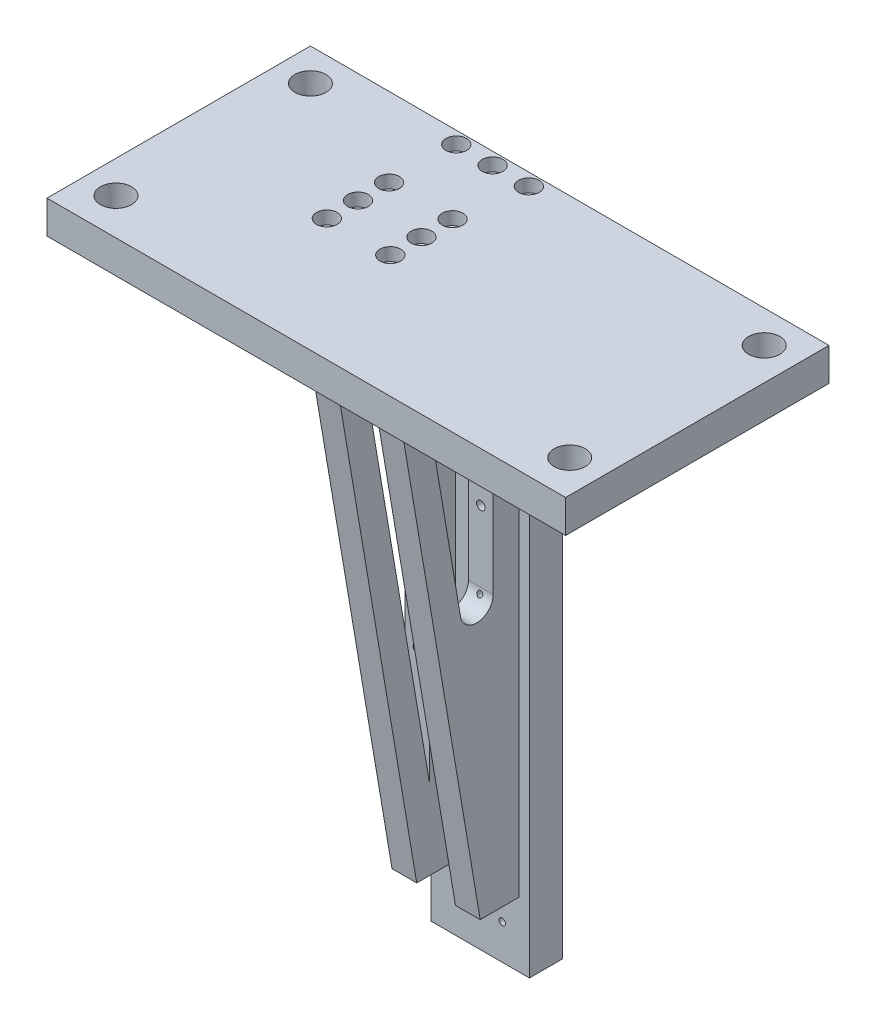
from build123d import *

# Parameters (mm, degrees)
BOSS_EXTRUDE5_DEPTH             = 125
BOSS_EXTRUDE5_DEPTH_BACK        = 75
SKETCH1_W                       = 101.6
SKETCH1_H                       = 9.525
SKETCH1_W_2                     = 87.07
SKETCH1_H_2                     = 3.175
SKETCH1_5_W                     = 9.525
SKETCH1_5_H                     = 250
BOSS_EXTRUDE6_DEPTH             = 19
BOSS_EXTRUDE7_DEPTH             = 3.175
SKETCH6_W                       = 20
SKETCH6_H                       = 5.005
SKETCH6_W_2                     = 5
SKETCH6_H_2                     = 5
BOSS_EXTRUDE8_DEPTH             = 3.175
BOSS_EXTRUDE9_START             = 5.475
BOSS_EXTRUDE9_DEPTH             = 9.525
BOSS_EXTRUDE10_START            = -9.475
BOSS_EXTRUDE10_DEPTH            = 9.525
FILLET1_R                       = 6.35
CBORE_FOR_M4_SHCS1_AT_2_COUNT   = 2
CBORE_FOR_M4_SHCS1_AT_2_PITCH   = 30
CBORE_FOR_M4_SHCS1_AT_3_COUNT   = 2
CBORE_FOR_M4_SHCS1_AT_3_PITCH   = 30
CBORE_FOR_M4_SHCS1_AT_4_COUNT   = 2
CBORE_FOR_M4_SHCS1_AT_4_PITCH   = 60
CBORE_FOR_M4_SHCS1_AT_5_COUNT   = 2
CBORE_FOR_M4_SHCS1_AT_5_PITCH   = 90
CBORE_FOR_M4_SHCS1_AT_6_COUNT   = 2
CBORE_FOR_M4_SHCS1_AT_6_PITCH   = 120
CBORE_FOR_M4_SHCS1_AT_7_COUNT   = 2
CBORE_FOR_M4_SHCS1_AT_7_PITCH   = 150
CBORE_FOR_M4_SHCS1_AT_8_COUNT   = 2
CBORE_FOR_M4_SHCS1_AT_8_PITCH   = 151.983636043
CBORE_FOR_M4_SHCS1_AT_9_COUNT   = 2
CBORE_FOR_M4_SHCS1_AT_9_PITCH   = 122.470509205
CBORE_FOR_M4_SHCS1_AT_10_COUNT  = 2
CBORE_FOR_M4_SHCS1_AT_10_PITCH  = 93.268567186
CBORE_FOR_M4_SHCS1_AT_11_COUNT  = 2
CBORE_FOR_M4_SHCS1_AT_11_PITCH  = 64.799889082
CBORE_FOR_M4_SHCS1_AT_12_COUNT  = 2
CBORE_FOR_M4_SHCS1_AT_12_PITCH  = 38.717252291
CBORE_FOR_M4_SHCS1_AT_13_COUNT  = 2
CBORE_FOR_M4_SHCS1_AT_13_PITCH  = 24.475
CBORE_FOR_M4_SHCS1_AT_14_COUNT  = 2
CBORE_FOR_M4_SHCS1_AT_14_PITCH  = 38.717252291
CBORE_FOR_M4_SHCS2_AT_2_COUNT   = 2
CBORE_FOR_M4_SHCS2_AT_2_PITCH   = 12
CBORE_FOR_M4_SHCS2_AT_3_COUNT   = 2
CBORE_FOR_M4_SHCS2_AT_3_PITCH   = 24
CBORE_FOR_M4_SHCS2_AT_4_COUNT   = 2
CBORE_FOR_M4_SHCS2_AT_4_PITCH   = 34.278646779
CBORE_FOR_M4_SHCS2_AT_5_COUNT   = 2
CBORE_FOR_M4_SHCS2_AT_5_PITCH   = 27.258496382
CBORE_FOR_M4_SHCS2_AT_6_COUNT   = 2
CBORE_FOR_M4_SHCS2_AT_6_PITCH   = 24.475
CBORE_FOR_M4_SHCS2_AT_7_COUNT   = 2
CBORE_FOR_M4_SHCS2_AT_7_PITCH   = 38.156523852
CBORE_FOR_M4_SHCS2_AT_8_COUNT   = 2
CBORE_FOR_M4_SHCS2_AT_8_PITCH   = 29.347407253
CBORE_FOR_M4_SHCS2_AT_9_COUNT   = 2
CBORE_FOR_M4_SHCS2_AT_9_PITCH   = 25.663598978
M4X0_7_TAPPED_HOLE1_AT_2_COUNT  = 2
M4X0_7_TAPPED_HOLE1_AT_2_PITCH  = 12
M4X0_7_TAPPED_HOLE1_AT_3_COUNT  = 2
M4X0_7_TAPPED_HOLE1_AT_3_PITCH  = 24
M4X0_7_TAPPED_HOLE1_AT_4_COUNT  = 2
M4X0_7_TAPPED_HOLE1_AT_4_PITCH  = 34.278646779
M4X0_7_TAPPED_HOLE1_AT_5_COUNT  = 2
M4X0_7_TAPPED_HOLE1_AT_5_PITCH  = 27.258496382
M4X0_7_TAPPED_HOLE1_AT_6_COUNT  = 2
M4X0_7_TAPPED_HOLE1_AT_6_PITCH  = 24.475
M4X0_7_TAPPED_HOLE2_AT_2_COUNT  = 2
M4X0_7_TAPPED_HOLE2_AT_2_PITCH  = 24.475
M4X0_7_TAPPED_HOLE2_AT_3_COUNT  = 2
M4X0_7_TAPPED_HOLE2_AT_3_PITCH  = 38.717252291
M4X0_7_TAPPED_HOLE2_AT_4_COUNT  = 2
M4X0_7_TAPPED_HOLE2_AT_4_PITCH  = 30
M4X0_7_TAPPED_HOLE2_AT_5_COUNT  = 2
M4X0_7_TAPPED_HOLE2_AT_5_PITCH  = 60
M4X0_7_TAPPED_HOLE2_AT_6_COUNT  = 2
M4X0_7_TAPPED_HOLE2_AT_6_PITCH  = 64.799889082
M4X0_7_TAPPED_HOLE2_AT_7_COUNT  = 2
M4X0_7_TAPPED_HOLE2_AT_7_PITCH  = 90
M4X0_7_TAPPED_HOLE2_AT_8_COUNT  = 2
M4X0_7_TAPPED_HOLE2_AT_8_PITCH  = 93.268567186
M4X0_7_TAPPED_HOLE2_AT_9_COUNT  = 2
M4X0_7_TAPPED_HOLE2_AT_9_PITCH  = 120
M4X0_7_TAPPED_HOLE2_AT_10_COUNT = 2
M4X0_7_TAPPED_HOLE2_AT_10_PITCH = 122.470509205
M4X0_7_TAPPED_HOLE2_AT_11_COUNT = 2
M4X0_7_TAPPED_HOLE2_AT_11_PITCH = 150
M4X0_7_TAPPED_HOLE2_AT_12_COUNT = 2
M4X0_7_TAPPED_HOLE2_AT_12_PITCH = 151.983636043
M4X0_7_TAPPED_HOLE2_AT_13_COUNT = 2
M4X0_7_TAPPED_HOLE2_AT_13_PITCH = 180
M4X0_7_TAPPED_HOLE2_AT_14_COUNT = 2
M4X0_7_TAPPED_HOLE2_AT_14_PITCH = 181.656339347
FILLET2_R                       = 6.35
SKETCH23_W                      = 80
SKETCH23_H                      = 14.53
SKETCH23_W_2                    = 35
BOSS_EXTRUDE11_DEPTH            = 3.175
SKETCH22_W                      = 6
SKETCH22_H                      = 259.525
M10_CLEARANCE_HOLE1_AT_2_COUNT  = 2
M10_CLEARANCE_HOLE1_AT_2_PITCH  = 75
M10_CLEARANCE_HOLE1_AT_3_COUNT  = 2
M10_CLEARANCE_HOLE1_AT_3_PITCH  = 190.394327647
M10_CLEARANCE_HOLE1_AT_4_COUNT  = 2
M10_CLEARANCE_HOLE1_AT_4_PITCH  = 175
FILLET3_R                       = 6.35
M4X0_7_TAPPED_HOLE3_AT_2_COUNT  = 2
M4X0_7_TAPPED_HOLE3_AT_2_PITCH  = 14
M4X0_7_TAPPED_HOLE3_AT_3_COUNT  = 2
M4X0_7_TAPPED_HOLE3_AT_3_PITCH  = 28
SKETCH28_W                      = 1.25
SKETCH28_H                      = 101.6
M3X0_5_TAPPED_HOLE1_AT_2_COUNT  = 2
M3X0_5_TAPPED_HOLE1_AT_2_PITCH  = 17
M3X0_5_TAPPED_HOLE1_AT_3_COUNT  = 2
M3X0_5_TAPPED_HOLE1_AT_3_PITCH  = 225
M3X0_5_TAPPED_HOLE1_AT_4_COUNT  = 2
M3X0_5_TAPPED_HOLE1_AT_4_PITCH  = 225.641308275


with BuildPart() as part:
    # Sketch1 → Boss-Extrude5 (new, two sides: drawn at the far end of the back side and taken through both)
    with BuildSketch(Plane(origin=(0, 0, 0), x_dir=(0, 0, -1), z_dir=(1, 0, 0)).offset(-BOSS_EXTRUDE5_DEPTH_BACK)):
        with Locations((-41.275, 4.7625)):
            Rectangle(SKETCH1_W, SKETCH1_H)
        with Locations((-48.54, -1.5875)):
            Rectangle(SKETCH1_W_2, SKETCH1_H_2)
    extrude(amount=BOSS_EXTRUDE5_DEPTH + BOSS_EXTRUDE5_DEPTH_BACK)

    # Sketch6 → Boss-Extrude8 (add)
    with BuildSketch(Plane.XZ):
        with Locations((0, 2.5025)):
            Rectangle(SKETCH6_W, SKETCH6_H)
        with Locations((21.5, -5.025)):
            Rectangle(SKETCH6_W_2, SKETCH6_H_2)
    extrude(amount=BOSS_EXTRUDE8_DEPTH)

    # Sketch15 → CBORE for M4 SHCS2 (revolve, cut)
    with BuildSketch(Plane(origin=(-14.2375, 9.525, 20.9), x_dir=(0, 0, 1), z_dir=(1, 0, 0))):
        Polygon((0, 0), (0, 259.525), (2.4, 259.525), (2.4, 5), (4, 5), (4, 0), align=None)
    cbore_for_m4_shcs2 = revolve(axis=Axis((-14.2375, 15.875, 20.9), (0, -1, 0)), mode=Mode.SUBTRACT)

    # CBORE for M4 SHCS2 at 2: CBORE for M4 SHCS2 ×2
    with Locations(*[(0, 0, i * CBORE_FOR_M4_SHCS2_AT_2_PITCH) for i in range(1, CBORE_FOR_M4_SHCS2_AT_2_COUNT)]):
        add(cbore_for_m4_shcs2, mode=Mode.SUBTRACT)

    # CBORE for M4 SHCS2 at 3: CBORE for M4 SHCS2 ×2
    with Locations(*[(0, 0, i * CBORE_FOR_M4_SHCS2_AT_3_PITCH) for i in range(1, CBORE_FOR_M4_SHCS2_AT_3_COUNT)]):
        add(cbore_for_m4_shcs2, mode=Mode.SUBTRACT)

    # CBORE for M4 SHCS2 at 4: CBORE for M4 SHCS2 ×2
    with Locations(*[Vector(0.7140013477716473, 0, 0.7001443246790418) * (i * CBORE_FOR_M4_SHCS2_AT_4_PITCH) for i in range(1, CBORE_FOR_M4_SHCS2_AT_4_COUNT)]):
        add(cbore_for_m4_shcs2, mode=Mode.SUBTRACT)

    # CBORE for M4 SHCS2 at 5: CBORE for M4 SHCS2 ×2
    with Locations(*[Vector(0.8978851825548811, 0, 0.4402297115692985) * (i * CBORE_FOR_M4_SHCS2_AT_5_PITCH) for i in range(1, CBORE_FOR_M4_SHCS2_AT_5_COUNT)]):
        add(cbore_for_m4_shcs2, mode=Mode.SUBTRACT)

    # CBORE for M4 SHCS2 at 6: CBORE for M4 SHCS2 ×2
    with Locations(*[(i * CBORE_FOR_M4_SHCS2_AT_6_PITCH, 0, 0) for i in range(1, CBORE_FOR_M4_SHCS2_AT_6_COUNT)]):
        add(cbore_for_m4_shcs2, mode=Mode.SUBTRACT)

    # CBORE for M4 SHCS2 at 7: CBORE for M4 SHCS2 ×2
    with Locations(*[Vector(0.7400438286574145, 0, -0.6725586455217683) * (i * CBORE_FOR_M4_SHCS2_AT_7_PITCH) for i in range(1, CBORE_FOR_M4_SHCS2_AT_7_COUNT)]):
        add(cbore_for_m4_shcs2, mode=Mode.SUBTRACT)

    # CBORE for M4 SHCS2 at 8: CBORE for M4 SHCS2 ×2
    with Locations(*[Vector(0.48513655318989135, 0, -0.8744384053545634) * (i * CBORE_FOR_M4_SHCS2_AT_8_PITCH) for i in range(1, CBORE_FOR_M4_SHCS2_AT_8_COUNT)]):
        add(cbore_for_m4_shcs2, mode=Mode.SUBTRACT)

    # CBORE for M4 SHCS2 at 9: CBORE for M4 SHCS2 ×2
    with Locations(*[Vector(0.009254352836647408, 0, -0.9999571775599068) * (i * CBORE_FOR_M4_SHCS2_AT_9_PITCH) for i in range(1, CBORE_FOR_M4_SHCS2_AT_9_COUNT)]):
        add(cbore_for_m4_shcs2, mode=Mode.SUBTRACT)

    # Fillet2
    # the kernel refuses this fillet: 6.35 mm, written as the material it adds along each edge
    with BuildSketch(Plane(origin=(10, 15.514806436, 5.005), x_dir=(1, 0, 0), z_dir=(0, -1, 0))) as fillet2_piece_1_section:
        with BuildLine():
            CenterArc((6.205922574, -6.35), FILLET2_R, 90, 77.771495999)
            Line((0, -5.005), (0, 0))
            Line((0, 0), (6.205922574, 0))
        make_face()
    fillet2_piece_1 = extrude(amount=18.689806436, mode=Mode.PRIVATE)
    fillet2_piece_1 = split(fillet2_piece_1, bisect_by=Plane(origin=(12.211613865, 9.525, 3.607721396), z_dir=(0, -1, 0)), keep=Keep.TOP, mode=Mode.PRIVATE)
    add(fillet2_piece_1)
    with BuildSketch(Plane(origin=(-10, 15.514806436, 5.005), x_dir=(-1, 0, 0), z_dir=(0, -1, 0))) as fillet2_piece_2_section:
        with BuildLine():
            CenterArc((6.205922574, 6.35), FILLET2_R, 192.228504001, 77.771495999)
            Line((0, 5.005), (0, 0))
            Line((0, 0), (6.205922574, 0))
        make_face()
    fillet2_piece_2 = extrude(amount=18.689806436, mode=Mode.PRIVATE)
    fillet2_piece_2 = split(fillet2_piece_2, bisect_by=Plane(origin=(-12.211613865, 9.525, 3.607721396), z_dir=(0, -1, 0)), keep=Keep.TOP, mode=Mode.PRIVATE)
    add(fillet2_piece_2)

    # Sketch23 → Boss-Extrude11 (add)
    with BuildSketch(Plane.XZ):
        with Locations((85, -2.26)):
            Rectangle(SKETCH23_W, SKETCH23_H)
        with Locations((-57.5, -2.26)):
            Rectangle(SKETCH23_W_2, SKETCH23_H)
    extrude(amount=BOSS_EXTRUDE11_DEPTH)

    # Sketch22 → M10 Clearance Hole1 (revolve, cut)
    with BuildSketch(Plane(origin=(-62.5, 9.525, 2.975), x_dir=(0, 0, 1), z_dir=(1, 0, 0))):
        with Locations((3, 129.7625)):
            Rectangle(SKETCH22_W, SKETCH22_H)
    m10_clearance_hole1 = revolve(axis=Axis((-62.5, 15.875, 2.975), (0, -1, 0)), mode=Mode.SUBTRACT)

    # M10 Clearance Hole1 at 2: M10 Clearance Hole1 ×2
    with Locations(*[(0, 0, i * M10_CLEARANCE_HOLE1_AT_2_PITCH) for i in range(1, M10_CLEARANCE_HOLE1_AT_2_COUNT)]):
        add(m10_clearance_hole1, mode=Mode.SUBTRACT)

    # M10 Clearance Hole1 at 3: M10 Clearance Hole1 ×2
    with Locations(*[Vector(0.919145030018058, 0, 0.3939192985791676) * (i * M10_CLEARANCE_HOLE1_AT_3_PITCH) for i in range(1, M10_CLEARANCE_HOLE1_AT_3_COUNT)]):
        add(m10_clearance_hole1, mode=Mode.SUBTRACT)

    # M10 Clearance Hole1 at 4: M10 Clearance Hole1 ×2
    with Locations(*[(i * M10_CLEARANCE_HOLE1_AT_4_PITCH, 0, 0) for i in range(1, M10_CLEARANCE_HOLE1_AT_4_COUNT)]):
        add(m10_clearance_hole1, mode=Mode.SUBTRACT)

    # Fillet3
    fillet3_edges = [part.edges().sort_by_distance(p)[0] for p in [
        (-40, -1.5875, 5.005),
        (45, -1.5875, 5.005),
    ]]
    fillet(fillet3_edges, radius=FILLET3_R)


with BuildPart() as body_2:
    # Sketch1<5> → Boss-Extrude6 (new, symmetric)
    with BuildSketch(Plane(origin=(0, 0, 0), x_dir=(0, 0, -1), z_dir=(1, 0, 0))):
        with Locations((4.7625, -125)):
            Rectangle(SKETCH1_5_W, SKETCH1_5_H)
    extrude(amount=BOSS_EXTRUDE6_DEPTH, both=True)

    # Sketch2 → Boss-Extrude7 (add)
    with BuildSketch(Plane(origin=(0, 0, -9.525), x_dir=(-1, 0, 0), z_dir=(0, 0, -1))):
        Polygon((-15, 0), (-19, 0), (-19, -250), (-15, -250), (-15, -36.089425347), (-15, -4.528231552), align=None)
    extrude(amount=BOSS_EXTRUDE7_DEPTH)

    # Sketch13 → CBORE for M4 SHCS1 (revolve, cut)
    with BuildSketch(Plane(origin=(10.2375, -61.5875, -9.525), x_dir=(0, 1, 0), z_dir=(1, 0, 0))):
        Polygon((0, 0), (0, 101.6), (2.4, 101.6), (2.4, 5), (4, 5), (4, 0), align=None)
    cbore_for_m4_shcs1 = revolve(axis=Axis((10.2375, -61.5875, -15.875), (0, 0, 1)), mode=Mode.SUBTRACT)

    # CBORE for M4 SHCS1 at 2: CBORE for M4 SHCS1 ×2
    with Locations(*[(0, i * CBORE_FOR_M4_SHCS1_AT_2_PITCH, 0) for i in range(1, CBORE_FOR_M4_SHCS1_AT_2_COUNT)]):
        add(cbore_for_m4_shcs1, mode=Mode.SUBTRACT)

    # CBORE for M4 SHCS1 at 3: CBORE for M4 SHCS1 ×2
    with Locations(*[(0, -i * CBORE_FOR_M4_SHCS1_AT_3_PITCH, 0) for i in range(1, CBORE_FOR_M4_SHCS1_AT_3_COUNT)]):
        add(cbore_for_m4_shcs1, mode=Mode.SUBTRACT)

    # CBORE for M4 SHCS1 at 4: CBORE for M4 SHCS1 ×2
    with Locations(*[(0, -i * CBORE_FOR_M4_SHCS1_AT_4_PITCH, 0) for i in range(1, CBORE_FOR_M4_SHCS1_AT_4_COUNT)]):
        add(cbore_for_m4_shcs1, mode=Mode.SUBTRACT)

    # CBORE for M4 SHCS1 at 5: CBORE for M4 SHCS1 ×2
    with Locations(*[(0, -i * CBORE_FOR_M4_SHCS1_AT_5_PITCH, 0) for i in range(1, CBORE_FOR_M4_SHCS1_AT_5_COUNT)]):
        add(cbore_for_m4_shcs1, mode=Mode.SUBTRACT)

    # CBORE for M4 SHCS1 at 6: CBORE for M4 SHCS1 ×2
    with Locations(*[(0, -i * CBORE_FOR_M4_SHCS1_AT_6_PITCH, 0) for i in range(1, CBORE_FOR_M4_SHCS1_AT_6_COUNT)]):
        add(cbore_for_m4_shcs1, mode=Mode.SUBTRACT)

    # CBORE for M4 SHCS1 at 7: CBORE for M4 SHCS1 ×2
    with Locations(*[(0, -i * CBORE_FOR_M4_SHCS1_AT_7_PITCH, 0) for i in range(1, CBORE_FOR_M4_SHCS1_AT_7_COUNT)]):
        add(cbore_for_m4_shcs1, mode=Mode.SUBTRACT)

    # CBORE for M4 SHCS1 at 8: CBORE for M4 SHCS1 ×2
    with Locations(*[Vector(-0.16103707370835982, -0.9869483577631852, 0) * (i * CBORE_FOR_M4_SHCS1_AT_8_PITCH) for i in range(1, CBORE_FOR_M4_SHCS1_AT_8_COUNT)]):
        add(cbore_for_m4_shcs1, mode=Mode.SUBTRACT)

    # CBORE for M4 SHCS1 at 9: CBORE for M4 SHCS1 ×2
    with Locations(*[Vector(-0.1998440290549988, -0.9798277216179714, 0) * (i * CBORE_FOR_M4_SHCS1_AT_9_PITCH) for i in range(1, CBORE_FOR_M4_SHCS1_AT_9_COUNT)]):
        add(cbore_for_m4_shcs1, mode=Mode.SUBTRACT)

    # CBORE for M4 SHCS1 at 10: CBORE for M4 SHCS1 ×2
    with Locations(*[Vector(-0.26241423813332126, -0.9649553189785052, 0) * (i * CBORE_FOR_M4_SHCS1_AT_10_PITCH) for i in range(1, CBORE_FOR_M4_SHCS1_AT_10_COUNT)]):
        add(cbore_for_m4_shcs1, mode=Mode.SUBTRACT)

    # CBORE for M4 SHCS1 at 11: CBORE for M4 SHCS1 ×2
    with Locations(*[Vector(-0.37770126379604785, -0.9259275108381154, 0) * (i * CBORE_FOR_M4_SHCS1_AT_11_PITCH) for i in range(1, CBORE_FOR_M4_SHCS1_AT_11_COUNT)]):
        add(cbore_for_m4_shcs1, mode=Mode.SUBTRACT)

    # CBORE for M4 SHCS1 at 12: CBORE for M4 SHCS1 ×2
    with Locations(*[Vector(-0.632147132130116, -0.7748483744189373, 0) * (i * CBORE_FOR_M4_SHCS1_AT_12_PITCH) for i in range(1, CBORE_FOR_M4_SHCS1_AT_12_COUNT)]):
        add(cbore_for_m4_shcs1, mode=Mode.SUBTRACT)

    # CBORE for M4 SHCS1 at 13: CBORE for M4 SHCS1 ×2
    with Locations(*[(-i * CBORE_FOR_M4_SHCS1_AT_13_PITCH, 0, 0) for i in range(1, CBORE_FOR_M4_SHCS1_AT_13_COUNT)]):
        add(cbore_for_m4_shcs1, mode=Mode.SUBTRACT)

    # CBORE for M4 SHCS1 at 14: CBORE for M4 SHCS1 ×2
    with Locations(*[Vector(-0.6321471321301159, 0.7748483744189375, 0) * (i * CBORE_FOR_M4_SHCS1_AT_14_PITCH) for i in range(1, CBORE_FOR_M4_SHCS1_AT_14_COUNT)]):
        add(cbore_for_m4_shcs1, mode=Mode.SUBTRACT)

    # Sketch25 → M4x0.7 Tapped Hole3 (revolve, cut)
    with BuildSketch(Plane(origin=(-14, 0, -4.7625), x_dir=(0, 0, 1), z_dir=(1, 0, 0))):
        Polygon((0, 0), (0, 11.091420021), (1.65, 10.1), (1.65, 0), align=None)
    m4x0_7_tapped_hole3 = revolve(axis=Axis((-14, 6.35, -4.7625), (0, -1, 0)), mode=Mode.SUBTRACT)

    # M4x0.7 Tapped Hole3 at 2: M4x0.7 Tapped Hole3 ×2
    with Locations(*[(i * M4X0_7_TAPPED_HOLE3_AT_2_PITCH, 0, 0) for i in range(1, M4X0_7_TAPPED_HOLE3_AT_2_COUNT)]):
        add(m4x0_7_tapped_hole3, mode=Mode.SUBTRACT)

    # M4x0.7 Tapped Hole3 at 3: M4x0.7 Tapped Hole3 ×2
    with Locations(*[(i * M4X0_7_TAPPED_HOLE3_AT_3_PITCH, 0, 0) for i in range(1, M4X0_7_TAPPED_HOLE3_AT_3_COUNT)]):
        add(m4x0_7_tapped_hole3, mode=Mode.SUBTRACT)

    # Sketch28 → M3x0.5 Tapped Hole1 (revolve, cut)
    with BuildSketch(Plane(origin=(8.5, -11.475, -9.525), x_dir=(0, 1, 0), z_dir=(1, 0, 0))):
        with Locations((0.625, 50.8)):
            Rectangle(SKETCH28_W, SKETCH28_H)
    m3x0_5_tapped_hole1 = revolve(axis=Axis((8.5, -11.475, -15.875), (0, 0, 1)), mode=Mode.SUBTRACT)

    # M3x0.5 Tapped Hole1 at 2: M3x0.5 Tapped Hole1 ×2
    with Locations(*[(-i * M3X0_5_TAPPED_HOLE1_AT_2_PITCH, 0, 0) for i in range(1, M3X0_5_TAPPED_HOLE1_AT_2_COUNT)]):
        add(m3x0_5_tapped_hole1, mode=Mode.SUBTRACT)

    # M3x0.5 Tapped Hole1 at 3: M3x0.5 Tapped Hole1 ×2
    with Locations(*[(0, -i * M3X0_5_TAPPED_HOLE1_AT_3_PITCH, 0) for i in range(1, M3X0_5_TAPPED_HOLE1_AT_3_COUNT)]):
        add(m3x0_5_tapped_hole1, mode=Mode.SUBTRACT)

    # M3x0.5 Tapped Hole1 at 4: M3x0.5 Tapped Hole1 ×2
    with Locations(*[Vector(-0.07534081472037138, -0.9971578418872665, 0) * (i * M3X0_5_TAPPED_HOLE1_AT_4_PITCH) for i in range(1, M3X0_5_TAPPED_HOLE1_AT_4_COUNT)]):
        add(m3x0_5_tapped_hole1, mode=Mode.SUBTRACT)


with BuildPart() as body_3:
    # Sketch5 → Boss-Extrude9 (new body)
    with BuildSketch(Plane(origin=(0, 0, 0), x_dir=(0, 0, -1), z_dir=(1, 0, 0)).offset(BOSS_EXTRUDE9_START)):
        with BuildLine():
            Line((-50.8, -3.175), (-50.8, -13.175))
            Line((-50.8, -13.175), (-15, -225))
            Line((-15, -225), (0, -225))
            Line((0, -225), (0, -18.175))
            Line((0, -18.175), (-8.65, -18.175))
            ThreePointArc((-8.65, -18.175), (-13.140128061, -16.315128061), (-15, -11.825))
            Line((-15, -11.825), (-15, -3.175))
            Line((-15, -3.175), (-50.8, -3.175))
        make_face()
        with BuildLine():
            Line((-40.658187967, -13.175), (-24.944170737, -13.175))
            ThreePointArc((-24.944170737, -13.175), (-20.211195872, -23.386195872), (-10, -28.119170737))
            Line((-10, -28.119170737), (-10, -194.576415252))
            Line((-10, -194.576415252), (-40.658187967, -13.175))
        make_face(mode=Mode.SUBTRACT)
    extrude(amount=BOSS_EXTRUDE9_DEPTH)

    # Fillet1
    fillet1_edges = [body_3.edges().sort_by_distance(p)[0] for p in [
        (10.2375, -13.175, 40.658187967),
        (10.2375, -194.576415252, 10),
        (10.2375, -28.119170737, 10),
        (10.2375, -13.175, 24.944170737),
    ]]
    fillet(fillet1_edges, radius=FILLET1_R)

    # Sketch17 → M4x0.7 Tapped Hole1 (revolve, cut)
    with BuildSketch(Plane(origin=(10.2375, -3.175, 20.9), x_dir=(0, 0, 1), z_dir=(1, 0, 0))):
        Polygon((0, 0), (0, 11.091420021), (1.65, 10.1), (1.65, 0), align=None)
    m4x0_7_tapped_hole1 = revolve(axis=Axis((10.2375, 3.175, 20.9), (0, -1, 0)), mode=Mode.SUBTRACT)

    # M4x0.7 Tapped Hole1 at 2: M4x0.7 Tapped Hole1 ×2
    with Locations(*[(0, 0, i * M4X0_7_TAPPED_HOLE1_AT_2_PITCH) for i in range(1, M4X0_7_TAPPED_HOLE1_AT_2_COUNT)]):
        add(m4x0_7_tapped_hole1, mode=Mode.SUBTRACT)

    # M4x0.7 Tapped Hole1 at 3: M4x0.7 Tapped Hole1 ×2
    with Locations(*[(0, 0, i * M4X0_7_TAPPED_HOLE1_AT_3_PITCH) for i in range(1, M4X0_7_TAPPED_HOLE1_AT_3_COUNT)]):
        add(m4x0_7_tapped_hole1, mode=Mode.SUBTRACT)

    # Sketch19 → M4x0.7 Tapped Hole2 (revolve, cut)
    with BuildSketch(Plane(origin=(10.2375, -31.5875, 0), x_dir=(0, 1, 0), z_dir=(1, 0, 0))):
        Polygon((0, 0), (0, 11.091420021), (1.65, 10.1), (1.65, 0), align=None)
    m4x0_7_tapped_hole2 = revolve(axis=Axis((10.2375, -31.5875, -6.35), (0, 0, 1)), mode=Mode.SUBTRACT)

    # M4x0.7 Tapped Hole2 at 4: M4x0.7 Tapped Hole2 ×2
    with Locations(*[(0, -i * M4X0_7_TAPPED_HOLE2_AT_4_PITCH, 0) for i in range(1, M4X0_7_TAPPED_HOLE2_AT_4_COUNT)]):
        add(m4x0_7_tapped_hole2, mode=Mode.SUBTRACT)

    # M4x0.7 Tapped Hole2 at 5: M4x0.7 Tapped Hole2 ×2
    with Locations(*[(0, -i * M4X0_7_TAPPED_HOLE2_AT_5_PITCH, 0) for i in range(1, M4X0_7_TAPPED_HOLE2_AT_5_COUNT)]):
        add(m4x0_7_tapped_hole2, mode=Mode.SUBTRACT)

    # M4x0.7 Tapped Hole2 at 7: M4x0.7 Tapped Hole2 ×2
    with Locations(*[(0, -i * M4X0_7_TAPPED_HOLE2_AT_7_PITCH, 0) for i in range(1, M4X0_7_TAPPED_HOLE2_AT_7_COUNT)]):
        add(m4x0_7_tapped_hole2, mode=Mode.SUBTRACT)

    # M4x0.7 Tapped Hole2 at 9: M4x0.7 Tapped Hole2 ×2
    with Locations(*[(0, -i * M4X0_7_TAPPED_HOLE2_AT_9_PITCH, 0) for i in range(1, M4X0_7_TAPPED_HOLE2_AT_9_COUNT)]):
        add(m4x0_7_tapped_hole2, mode=Mode.SUBTRACT)

    # M4x0.7 Tapped Hole2 at 11: M4x0.7 Tapped Hole2 ×2
    with Locations(*[(0, -i * M4X0_7_TAPPED_HOLE2_AT_11_PITCH, 0) for i in range(1, M4X0_7_TAPPED_HOLE2_AT_11_COUNT)]):
        add(m4x0_7_tapped_hole2, mode=Mode.SUBTRACT)

    # M4x0.7 Tapped Hole2 at 13: M4x0.7 Tapped Hole2 ×2
    with Locations(*[(0, -i * M4X0_7_TAPPED_HOLE2_AT_13_PITCH, 0) for i in range(1, M4X0_7_TAPPED_HOLE2_AT_13_COUNT)]):
        add(m4x0_7_tapped_hole2, mode=Mode.SUBTRACT)


with BuildPart() as body_4:
    # Sketch5<3> → Boss-Extrude10 (new body)
    with BuildSketch(Plane(origin=(0, 0, 0), x_dir=(0, 0, -1), z_dir=(1, 0, 0)).offset(BOSS_EXTRUDE10_START)):
        with BuildLine():
            Line((-50.8, -3.175), (-50.8, -13.175))
            Line((-50.8, -13.175), (-15, -225))
            Line((-15, -225), (0, -225))
            Line((0, -225), (0, -18.175))
            Line((0, -18.175), (-8.65, -18.175))
            ThreePointArc((-8.65, -18.175), (-13.140128061, -16.315128061), (-15, -11.825))
            Line((-15, -11.825), (-15, -3.175))
            Line((-15, -3.175), (-50.8, -3.175))
        make_face()
        with BuildLine():
            Line((-40.658187967, -13.175), (-24.944170737, -13.175))
            ThreePointArc((-24.944170737, -13.175), (-20.211195872, -23.386195872), (-10, -28.119170737))
            Line((-10, -28.119170737), (-10, -194.576415252))
            Line((-10, -194.576415252), (-40.658187967, -13.175))
        make_face(mode=Mode.SUBTRACT)
    extrude(amount=-BOSS_EXTRUDE10_DEPTH)

    # M4x0.7 Tapped Hole1 at 4: M4x0.7 Tapped Hole1 ×2
    with Locations(*[Vector(-0.7140013477716471, 0, 0.7001443246790418) * (i * M4X0_7_TAPPED_HOLE1_AT_4_PITCH) for i in range(1, M4X0_7_TAPPED_HOLE1_AT_4_COUNT)]):
        add(m4x0_7_tapped_hole1, mode=Mode.SUBTRACT)

    # M4x0.7 Tapped Hole1 at 5: M4x0.7 Tapped Hole1 ×2
    with Locations(*[Vector(-0.8978851825548811, 0, 0.4402297115692986) * (i * M4X0_7_TAPPED_HOLE1_AT_5_PITCH) for i in range(1, M4X0_7_TAPPED_HOLE1_AT_5_COUNT)]):
        add(m4x0_7_tapped_hole1, mode=Mode.SUBTRACT)

    # M4x0.7 Tapped Hole1 at 6: M4x0.7 Tapped Hole1 ×2
    with Locations(*[(-i * M4X0_7_TAPPED_HOLE1_AT_6_PITCH, 0, 0) for i in range(1, M4X0_7_TAPPED_HOLE1_AT_6_COUNT)]):
        add(m4x0_7_tapped_hole1, mode=Mode.SUBTRACT)

    # M4x0.7 Tapped Hole2 at 2: M4x0.7 Tapped Hole2 ×2
    with Locations(*[(-i * M4X0_7_TAPPED_HOLE2_AT_2_PITCH, 0, 0) for i in range(1, M4X0_7_TAPPED_HOLE2_AT_2_COUNT)]):
        add(m4x0_7_tapped_hole2, mode=Mode.SUBTRACT)

    # M4x0.7 Tapped Hole2 at 3: M4x0.7 Tapped Hole2 ×2
    with Locations(*[Vector(-0.632147132130116, -0.7748483744189375, 0) * (i * M4X0_7_TAPPED_HOLE2_AT_3_PITCH) for i in range(1, M4X0_7_TAPPED_HOLE2_AT_3_COUNT)]):
        add(m4x0_7_tapped_hole2, mode=Mode.SUBTRACT)

    # M4x0.7 Tapped Hole2 at 6: M4x0.7 Tapped Hole2 ×2
    with Locations(*[Vector(-0.37770126379604774, -0.9259275108381155, 0) * (i * M4X0_7_TAPPED_HOLE2_AT_6_PITCH) for i in range(1, M4X0_7_TAPPED_HOLE2_AT_6_COUNT)]):
        add(m4x0_7_tapped_hole2, mode=Mode.SUBTRACT)

    # M4x0.7 Tapped Hole2 at 8: M4x0.7 Tapped Hole2 ×2
    with Locations(*[Vector(-0.2624142381333212, -0.9649553189785052, 0) * (i * M4X0_7_TAPPED_HOLE2_AT_8_PITCH) for i in range(1, M4X0_7_TAPPED_HOLE2_AT_8_COUNT)]):
        add(m4x0_7_tapped_hole2, mode=Mode.SUBTRACT)

    # M4x0.7 Tapped Hole2 at 10: M4x0.7 Tapped Hole2 ×2
    with Locations(*[Vector(-0.19984402905499873, -0.9798277216179714, 0) * (i * M4X0_7_TAPPED_HOLE2_AT_10_PITCH) for i in range(1, M4X0_7_TAPPED_HOLE2_AT_10_COUNT)]):
        add(m4x0_7_tapped_hole2, mode=Mode.SUBTRACT)

    # M4x0.7 Tapped Hole2 at 12: M4x0.7 Tapped Hole2 ×2
    with Locations(*[Vector(-0.16103707370835982, -0.9869483577631853, 0) * (i * M4X0_7_TAPPED_HOLE2_AT_12_PITCH) for i in range(1, M4X0_7_TAPPED_HOLE2_AT_12_COUNT)]):
        add(m4x0_7_tapped_hole2, mode=Mode.SUBTRACT)

    # M4x0.7 Tapped Hole2 at 14: M4x0.7 Tapped Hole2 ×2
    with Locations(*[Vector(-0.13473242986158726, -0.990882017368159, 0) * (i * M4X0_7_TAPPED_HOLE2_AT_14_PITCH) for i in range(1, M4X0_7_TAPPED_HOLE2_AT_14_COUNT)]):
        add(m4x0_7_tapped_hole2, mode=Mode.SUBTRACT)


solid = Compound([part.part, body_2.part, body_3.part, body_4.part])
